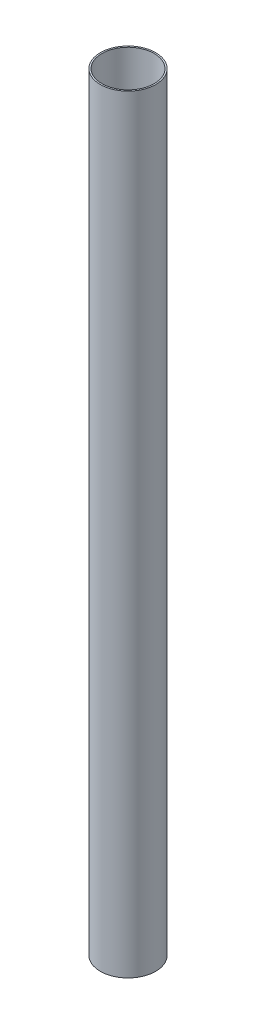
from build123d import *

# Parameters (mm, degrees)
SKETCH1_W = 1.4732
SKETCH1_H = 749.3


with BuildPart() as part:
    # Sketch1 → Revolve1 (revolve)
    with BuildSketch(Plane.XY):
        with Locations((26.2509, -288.957384645)):
            Rectangle(SKETCH1_W, SKETCH1_H)
    revolve(axis=Axis((0, 0, 0), (0, 1, 0)))


solid = part.part
